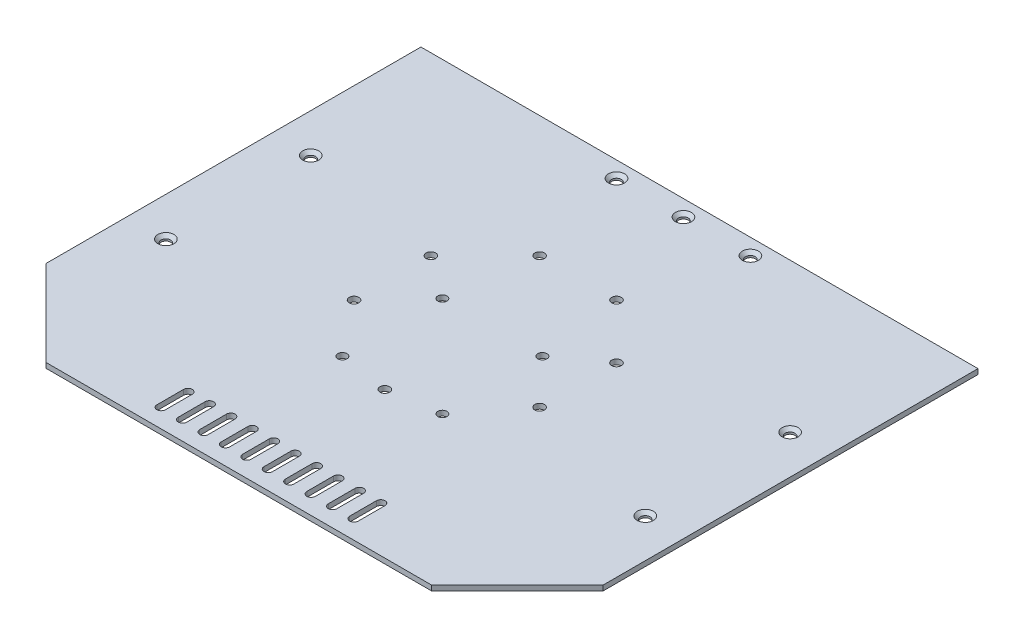
from build123d import *

# Parameters (mm, degrees)
SKETCH1_W          = 520
SKETCH1_H          = 430
BASE_FLANGE1_DEPTH = 4.78
SKETCH6_R          = 4.5
CUT_EXTRUDE1_DEPTH = 10
CHAMFER1_SIZE      = 80
SKETCH7_R          = 4.5
CUT_EXTRUDE2_DEPTH = 10
SKETCH8_R          = 4.25
CUT_EXTRUDE3_DEPTH = 10
SKETCH9_R          = 4.5
CUT_EXTRUDE4_DEPTH = 10
CUT_EXTRUDE5_DEPTH = 10
CHAMFER2_SIZE      = 3


# Sheet-metal steps are written as plain solids
with BuildPart() as part:
    # Sketch1 → Base-Flange1 (new body)
    with BuildSketch(Plane(origin=(0, 0, 0), x_dir=(1, 0, 0), z_dir=(0, 1, 0))):
        with Locations((0, -215)):
            Rectangle(SKETCH1_W, SKETCH1_H)
    extrude(amount=-BASE_FLANGE1_DEPTH)

    # Sketch6 → Cut-Extrude1 (cut)
    with BuildSketch(Plane(origin=(0, 0, 0), x_dir=(1, 0, 0), z_dir=(0, 1, 0))):
        with Locations(Location((62.5, -14.9625, 0), (0, 0, 270))):
            Circle(SKETCH6_R)
        with Locations(Location((0, -14.9625, 0), (0, 0, 270))):
            Circle(SKETCH6_R)
        with Locations(Location((-62.5, -14.9625, 0), (0, 0, 270))):
            Circle(SKETCH6_R)
    extrude(amount=-CUT_EXTRUDE1_DEPTH, mode=Mode.SUBTRACT)

    # Chamfer1
    chamfer1_edges = [part.edges().sort_by_distance(p)[0] for p in [
        (260, -2.39, 430),
        (-260, -2.39, 430),
    ]]
    chamfer(chamfer1_edges, length=CHAMFER1_SIZE)

    # Sketch7 → Cut-Extrude2 (cut)
    with BuildSketch(Plane(origin=(0, 0, 0), x_dir=(1, 0, 0), z_dir=(0, 1, 0))):
        with Locations(Location((-223.749160028, -139.138800169, 0), (0, 0, 270))):
            Circle(SKETCH7_R)
        with Locations(Location((-223.749160028, -274.331266718, 0), (0, 0, 270))):
            Circle(SKETCH7_R)
        with Locations(Location((223.749160028, -274.331266718, 0), (0, 0, 90))):
            Circle(SKETCH7_R)
        with Locations(Location((223.749160028, -139.138800169, 0), (0, 0, 90))):
            Circle(SKETCH7_R)
    extrude(amount=-CUT_EXTRUDE2_DEPTH, mode=Mode.SUBTRACT)

    # Sketch8 → Cut-Extrude3 (cut)
    with BuildSketch(Plane(origin=(0, 0, 0), x_dir=(1, 0, 0), z_dir=(0, 1, 0))):
        with Locations(Location((46.669047558, -193.293452442, 0), (0, 0, 270))):
            Circle(SKETCH8_R)
        with Locations(Location((46.669047558, -286.631547558, 0), (0, 0, 270))):
            Circle(SKETCH8_R)
        with Locations(Location((-46.669047558, -286.631547558, 0), (0, 0, 270))):
            Circle(SKETCH8_R)
        with Locations(Location((-46.669047558, -193.293452442, 0), (0, 0, 270))):
            Circle(SKETCH8_R)
    extrude(amount=-CUT_EXTRUDE3_DEPTH, mode=Mode.SUBTRACT)

    # Sketch9 → Cut-Extrude4 (cut)
    with BuildSketch(Plane(origin=(0, 0, 0), x_dir=(1, 0, 0), z_dir=(0, 1, 0))):
        with Locations(Location((86.613706173, -164.085928216, 0), (0, 0, 270))):
            Circle(SKETCH9_R)
        with Locations(Location((86.613706173, -235.839071784, 0), (0, 0, 270))):
            Circle(SKETCH9_R)
        with Locations(Location((35.876571784, -113.348793827, 0), (0, 0, 270))):
            Circle(SKETCH9_R)
        with Locations(Location((-35.876571784, -113.348793827, 0), (0, 0, 270))):
            Circle(SKETCH9_R)
        with Locations(Location((-86.613706173, -164.085928216, 0), (0, 0, 270))):
            Circle(SKETCH9_R)
        with Locations(Location((-86.613706173, -235.839071784, 0), (0, 0, 270))):
            Circle(SKETCH9_R)
        with Locations(Location((0, -293.7125, 0), (0, 0, 270))):
            Circle(SKETCH9_R)
    extrude(amount=-CUT_EXTRUDE4_DEPTH, mode=Mode.SUBTRACT)

    # Sketch10 → Cut-Extrude5 (cut)
    with BuildSketch(Plane(origin=(0, 0, 0), x_dir=(1, 0, 0), z_dir=(0, 1, 0))):
        with BuildLine():
            Line((-14, -412.5), (-14, -387.5))
            ThreePointArc((-14, -387.5), (-10, -383.5), (-6, -387.5))
            Line((-6, -387.5), (-6, -412.5))
            ThreePointArc((-6, -412.5), (-10, -416.5), (-14, -412.5))
        make_face()
        with BuildLine():
            Line((-34, -412.5), (-34, -387.5))
            ThreePointArc((-34, -387.5), (-30, -383.5), (-26, -387.5))
            Line((-26, -387.5), (-26, -412.5))
            ThreePointArc((-26, -412.5), (-30, -416.5), (-34, -412.5))
        make_face()
        with BuildLine():
            Line((-54, -412.5), (-54, -387.5))
            ThreePointArc((-54, -387.5), (-50, -383.5), (-46, -387.5))
            Line((-46, -387.5), (-46, -412.5))
            ThreePointArc((-46, -412.5), (-50, -416.5), (-54, -412.5))
        make_face()
        with BuildLine():
            Line((-74, -412.5), (-74, -387.5))
            ThreePointArc((-74, -387.5), (-70, -383.5), (-66, -387.5))
            Line((-66, -387.5), (-66, -412.5))
            ThreePointArc((-66, -412.5), (-70, -416.5), (-74, -412.5))
        make_face()
        with BuildLine():
            Line((-94, -412.5), (-94, -387.5))
            ThreePointArc((-94, -387.5), (-90, -383.5), (-86, -387.5))
            Line((-86, -387.5), (-86, -412.5))
            ThreePointArc((-86, -412.5), (-90, -416.5), (-94, -412.5))
        make_face()
        with BuildLine():
            Line((14, -412.5), (14, -387.5))
            ThreePointArc((14, -387.5), (10, -383.5), (6, -387.5))
            Line((6, -387.5), (6, -412.5))
            ThreePointArc((6, -412.5), (10, -416.5), (14, -412.5))
        make_face()
        with BuildLine():
            Line((34, -412.5), (34, -387.5))
            ThreePointArc((34, -387.5), (30, -383.5), (26, -387.5))
            Line((26, -387.5), (26, -412.5))
            ThreePointArc((26, -412.5), (30, -416.5), (34, -412.5))
        make_face()
        with BuildLine():
            Line((54, -412.5), (54, -387.5))
            ThreePointArc((54, -387.5), (50, -383.5), (46, -387.5))
            Line((46, -387.5), (46, -412.5))
            ThreePointArc((46, -412.5), (50, -416.5), (54, -412.5))
        make_face()
        with BuildLine():
            Line((74, -412.5), (74, -387.5))
            ThreePointArc((74, -387.5), (70, -383.5), (66, -387.5))
            Line((66, -387.5), (66, -412.5))
            ThreePointArc((66, -412.5), (70, -416.5), (74, -412.5))
        make_face()
        with BuildLine():
            Line((94, -412.5), (94, -387.5))
            ThreePointArc((94, -387.5), (90, -383.5), (86, -387.5))
            Line((86, -387.5), (86, -412.5))
            ThreePointArc((86, -412.5), (90, -416.5), (94, -412.5))
        make_face()
    extrude(amount=-CUT_EXTRUDE5_DEPTH, mode=Mode.SUBTRACT)

    # Chamfer2
    chamfer2_edges = [part.edges().sort_by_distance(p)[0] for p in [
        (62.5, 0, 10.4625),
        (0, 0, 10.4625),
        (-62.5, 0, 10.4625),
        (-223.749160028, 0, 134.638800169),
        (-223.749160028, 0, 269.831266718),
        (223.749160028, 0, 278.831266718),
        (223.749160028, 0, 143.638800169),
    ]]
    chamfer(chamfer2_edges, length=CHAMFER2_SIZE)


solid = part.part
